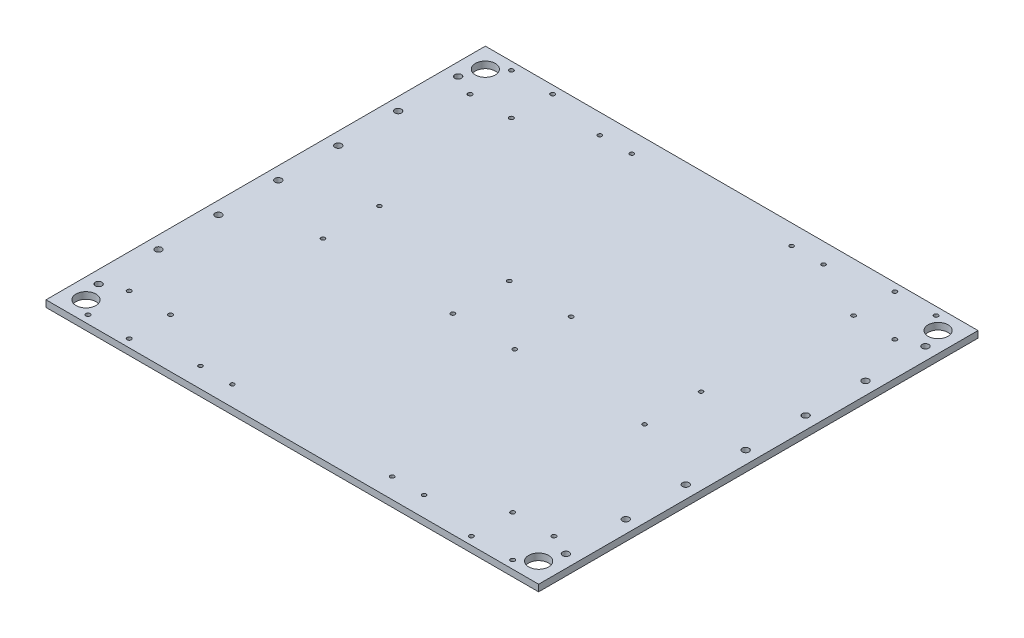
from build123d import *

# Parameters (mm, degrees)
SKETCH_1_W          = 370
SKETCH_1_H          = 330
EXTRUDE_1_DEPTH     = 5
SKETCH_2_R          = 1.6
SKETCH_2_R_2        = 1.602203763
CUT_EXTRUDE_1_DEPTH = 248.941525364
SKETCH_3_W          = 220
SKETCH_3_H          = 20
CUT_EXTRUDE_2_DEPTH = 248.941525364
SKETCH_9_W          = 239.54111937
SKETCH_9_H          = 233.56752537
EXTRUDE_2_DEPTH     = 5
SKETCH_12_R         = 2.5
CUT_EXTRUDE_6_DEPTH = 10
SKETCH_13_R         = 7.5
CUT_EXTRUDE_7_DEPTH = 10
SKETCH_14_R         = 1.505
SKETCH_14_R_2       = 1.55
CUT_EXTRUDE_8_DEPTH = 10


with BuildPart() as part:
    # 草图1 → 凸台-拉伸1 (new body)
    with BuildSketch(Plane(origin=(0, 0, 0), x_dir=(1, 0, 0), z_dir=(0, 1, 0))):
        Rectangle(SKETCH_1_W, SKETCH_1_H)
    extrude(amount=EXTRUDE_1_DEPTH)

    # 草图2 → 切除-拉伸1 (cut, through all)
    with BuildSketch(Plane(origin=(0, 5, 0), x_dir=(1, 0, 0), z_dir=(0, 1, 0))):
        with Locations((-159.5, 159)):
            Circle(SKETCH_2_R)
        with Locations((-128.5, 159)):
            Circle(SKETCH_2_R)
        with Locations((-159.5, 128)):
            Circle(SKETCH_2_R_2)
        with Locations((-128.5, 128)):
            Circle(SKETCH_2_R)
        with Locations((128.5, 159)):
            Circle(SKETCH_2_R)
        with Locations((159.5, 159)):
            Circle(SKETCH_2_R)
        with Locations((128.5, 128)):
            Circle(SKETCH_2_R)
        with Locations((159.5, 128)):
            Circle(SKETCH_2_R)
        with Locations((128.5, -128)):
            Circle(SKETCH_2_R)
        with Locations((159.5, -128)):
            Circle(SKETCH_2_R)
        with Locations((159.5, -159)):
            Circle(SKETCH_2_R)
        with Locations((128.5, -159)):
            Circle(SKETCH_2_R)
        with Locations((-128.5, -159)):
            Circle(SKETCH_2_R)
        with Locations((-159.5, -159)):
            Circle(SKETCH_2_R)
        with Locations((-159.5, -128)):
            Circle(SKETCH_2_R)
        with Locations((-128.5, -128)):
            Circle(SKETCH_2_R)
    extrude(amount=-CUT_EXTRUDE_1_DEPTH, mode=Mode.SUBTRACT)

    # 草图3 → 切除-拉伸2 (cut, through all)
    with BuildSketch(Plane(origin=(0, 5, 0), x_dir=(1, 0, 0), z_dir=(0, 1, 0))):
        with Locations((0, 50)):
            Rectangle(SKETCH_3_W, SKETCH_3_H)
        with Locations((0, 100)):
            Rectangle(SKETCH_3_W, SKETCH_3_H)
        Rectangle(SKETCH_3_W, SKETCH_3_H)
        with Locations((0, -50)):
            Rectangle(SKETCH_3_W, SKETCH_3_H)
        with Locations((0, -100)):
            Rectangle(SKETCH_3_W, SKETCH_3_H)
    extrude(amount=-CUT_EXTRUDE_2_DEPTH, mode=Mode.SUBTRACT)

    # 草图9 → 凸台-拉伸2 (add)
    with BuildSketch(Plane(origin=(0, 5, 0), x_dir=(1, 0, 0), z_dir=(0, 1, 0))):
        with Locations((2.0907579, 0.2986797)):
            Rectangle(SKETCH_9_W, SKETCH_9_H)
    extrude(amount=-EXTRUDE_2_DEPTH)

    # 草图12 → 切除-拉伸6 (cut)
    with BuildSketch(Plane(origin=(0, 5, 0), x_dir=(1, 0, 0), z_dir=(0, 1, 0))):
        with Locations((175.5, 0)):
            Circle(SKETCH_12_R)
        with Locations((175.5, 45)):
            Circle(SKETCH_12_R)
        with Locations((175.5, 90)):
            Circle(SKETCH_12_R)
        with Locations((175.5, 135)):
            Circle(SKETCH_12_R)
        with Locations((175.5, -135)):
            Circle(SKETCH_12_R)
        with Locations((175.5, -90)):
            Circle(SKETCH_12_R)
        with Locations((175.5, -45)):
            Circle(SKETCH_12_R)
        with Locations((-175.5, -45)):
            Circle(SKETCH_12_R)
        with Locations((-175.5, -90)):
            Circle(SKETCH_12_R)
        with Locations((-175.5, -135)):
            Circle(SKETCH_12_R)
        with Locations((-175.5, 135)):
            Circle(SKETCH_12_R)
        with Locations((-175.5, 90)):
            Circle(SKETCH_12_R)
        with Locations((-175.5, 45)):
            Circle(SKETCH_12_R)
        with Locations((-175.5, 0)):
            Circle(SKETCH_12_R)
    extrude(amount=-CUT_EXTRUDE_6_DEPTH, mode=Mode.SUBTRACT)

    # 草图13 → 切除-拉伸7 (cut)
    with BuildSketch(Plane(origin=(0, 5, 0), x_dir=(1, 0, 0), z_dir=(0, 1, 0))):
        with Locations((-170, -150)):
            Circle(SKETCH_13_R)
        with Locations((170, -150)):
            Circle(SKETCH_13_R)
        with Locations((170, 150)):
            Circle(SKETCH_13_R)
        with Locations((-170, 150)):
            Circle(SKETCH_13_R)
    extrude(amount=-CUT_EXTRUDE_7_DEPTH, mode=Mode.SUBTRACT)

    # 草图14 → 切除-拉伸8 (cut)
    with BuildSketch(Plane(origin=(0, 5, 0), x_dir=(1, 0, 0), z_dir=(0, 1, 0))):
        with Locations((-84, 150)):
            Circle(SKETCH_14_R)
        with Locations((-60, 150)):
            Circle(SKETCH_14_R)
        with Locations((-120.786796564, 21.213203436)):
            Circle(SKETCH_14_R)
        with Locations((-23.213203436, 21.213203436)):
            Circle(SKETCH_14_R_2)
        with Locations((23.213203436, 21.213203436)):
            Circle(SKETCH_14_R_2)
        with Locations((120.786796564, 21.213203436)):
            Circle(SKETCH_14_R)
        with Locations((84, 150)):
            Circle(SKETCH_14_R)
        with Locations((60, 150)):
            Circle(SKETCH_14_R)
        with Locations((84, -150)):
            Circle(SKETCH_14_R)
        with Locations((60, -150)):
            Circle(SKETCH_14_R)
        with Locations((120.786796564, -21.213203436)):
            Circle(SKETCH_14_R)
        with Locations((23.213203436, -21.213203436)):
            Circle(SKETCH_14_R_2)
        with Locations((-23.213203436, -21.213203436)):
            Circle(SKETCH_14_R_2)
        with Locations((-120.786796564, -21.213203436)):
            Circle(SKETCH_14_R)
        with Locations((-84, -150)):
            Circle(SKETCH_14_R)
        with Locations((-60, -150)):
            Circle(SKETCH_14_R)
    extrude(amount=-CUT_EXTRUDE_8_DEPTH, mode=Mode.SUBTRACT)


solid = part.part
